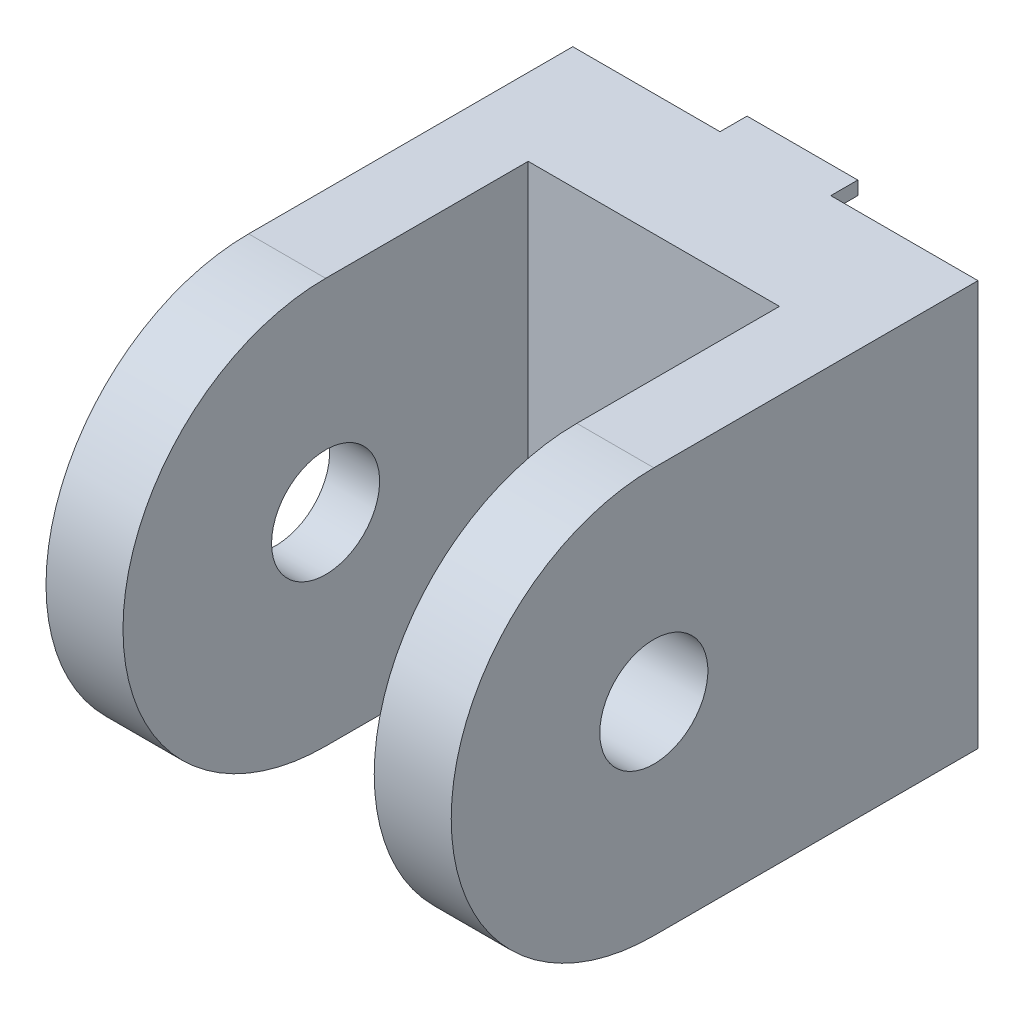
from build123d import *

# Parameters (mm, degrees)
SKETCH_1_W          = 30
SKETCH_1_H          = 30
EXTRUDE_1_DEPTH     = 9
SKETCH_2_W          = 5.7
SKETCH_2_H          = 30
EXTRUDE_2_DEPTH     = 30
CUT_EXTRUDE_START   = -30
CUT_EXTRUDE_2_DEPTH = 30
SKETCH_4_R          = 4
CUT_EXTRUDE_3_DEPTH = 52.439284598
SKETCH_5_R          = 8
CUT_EXTRUDE_4_DEPTH = 2
SKETCH_6_R          = 4
CUT_EXTRUDE_5_DEPTH = 37.742346142
SKETCH_7_W          = 8.2
SKETCH_7_H          = 1
EXTRUDE_3_DEPTH     = 2


# Read off the part's stored shape, not the designer's step: 切除-拉伸2
with BuildPart() as part:
    # 草图1 → 凸台-拉伸1 (new body)
    with BuildSketch(Plane.XY):
        Rectangle(SKETCH_1_W, SKETCH_1_H)
    extrude(amount=EXTRUDE_1_DEPTH)

    # 草图2 → 凸台-拉伸2 (add)
    with BuildSketch(Plane.XY.offset(9)):
        with Locations((-12.15, 0)):
            Rectangle(SKETCH_2_W, SKETCH_2_H)
        with Locations((12.15, 0)):
            Rectangle(SKETCH_2_W, SKETCH_2_H)
    extrude(amount=EXTRUDE_2_DEPTH)

    # 切除-拉伸2 outline → 切除-拉伸2 (cut)
    with BuildSketch(Plane.ZY.offset(15).offset(CUT_EXTRUDE_START)):
        with BuildLine():
            Line((39, 15), (24, 15))
            ThreePointArc((24, 15), (34.606601718, 10.606601718), (39, 0))
            Line((39, 0), (39, 15))
        make_face()
        with BuildLine():
            Line((39, -15), (39, 0))
            ThreePointArc((39, 0), (34.606601718, -10.606601718), (24, -15))
            Line((24, -15), (39, -15))
        make_face()
    extrude(amount=CUT_EXTRUDE_2_DEPTH, mode=Mode.SUBTRACT)

    # 草图4 → 切除-拉伸3 (cut, through all)
    with BuildSketch(Plane.ZY.offset(15)):
        with Locations((24, 0)):
            Circle(SKETCH_4_R)
    extrude(amount=-CUT_EXTRUDE_3_DEPTH, mode=Mode.SUBTRACT)

    # 草图5 → 切除-拉伸4 (cut)
    with BuildSketch(Plane.ZY.offset(15)):
        with Locations((24, 0)):
            Circle(SKETCH_5_R)
    extrude(amount=-CUT_EXTRUDE_4_DEPTH, mode=Mode.SUBTRACT)

    # 草图6 → 切除-拉伸5 (cut, through all)
    with BuildSketch(Plane.XY.offset(9)):
        Circle(SKETCH_6_R)
    extrude(amount=-CUT_EXTRUDE_5_DEPTH, mode=Mode.SUBTRACT)

    # 草图7 → 凸台-拉伸3 (add)
    with BuildSketch(Plane(origin=(0, 0, 0), x_dir=(-1, 0, 0), z_dir=(0, 0, -1))):
        with Locations((0, 14.5)):
            Rectangle(SKETCH_7_W, SKETCH_7_H)
        with Locations((0, -14.5)):
            Rectangle(SKETCH_7_W, SKETCH_7_H)
    extrude(amount=EXTRUDE_3_DEPTH)


solid = part.part
